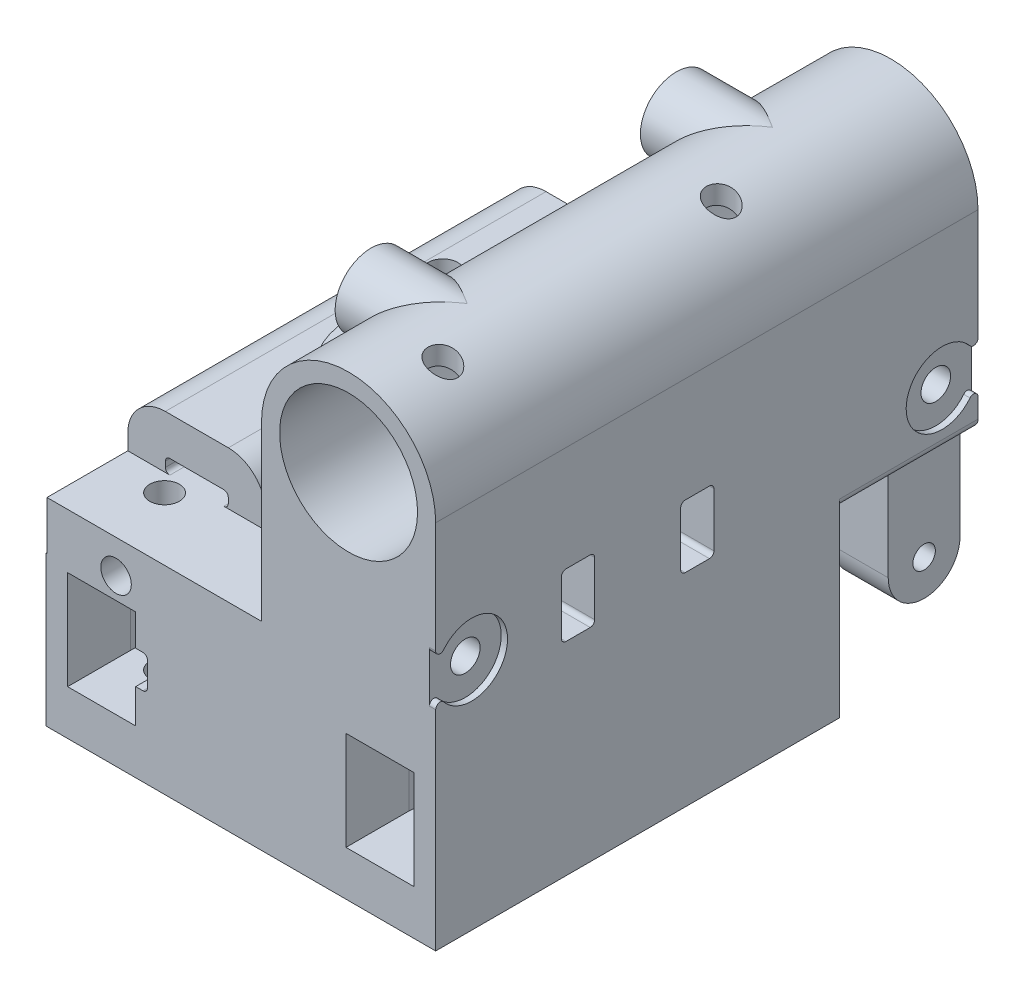
from build123d import *

# Parameters (mm, degrees)
SKETCH1_R                       = 7.68
SKETCH1_R_2                     = 1.7
BOSS_EXTRUDE1_DEPTH             = 60.4
BOSS_EXTRUDE3_DEPTH             = 34.02
SKETCH4_R                       = 8.49
CUT_EXTRUDE1_DEPTH              = 32
CUT_EXTRUDE2_DEPTH              = 30.2
CUT_EXTRUDE4_REACH              = 87.073
SKETCH3_R                       = 1.65
CUT_EXTRUDE5_DEPTH              = 0.7
SKETCH10_R                      = 3.6
CUT_EXTRUDE6_DEPTH              = 0.4
CUT_EXTRUDE8_DEPTH              = 15.4
CUT_EXTRUDE9_DEPTH              = 9
SKETCH6_R                       = 1.65
CUT_EXTRUDE10_DEPTH             = 86.935150038
SKETCH16_R                      = 11.5
CUT_EXTRUDE11_DEPTH             = 2.5
CUT_EXTRUDE12_START             = -9
CUT_EXTRUDE12_DEPTH             = 9
CUT_EXTRUDE13_START             = -5
SKETCH12_R                      = 3.79
CUT_EXTRUDE13_DEPTH             = 11
BOSS_EXTRUDE4_REACH             = 79.006
BOSS_EXTRUDE4_END_RADIUS        = 9.7
SKETCH20_R                      = 4
BOSS_EXTRUDE4_DIRECTION_2_DEPTH = 1
CUT_EXTRUDE14_REACH             = 78.7
SKETCH19_R                      = 1.65
BOSS_EXTRUDE5_START             = -2
SKETCH21_R                      = 1.25
BOSS_EXTRUDE5_DEPTH             = 6
CUT_EXTRUDE15_DEPTH             = 8


with BuildPart() as part:
    # Sketch1 → Boss-Extrude1 (new body)
    with BuildSketch(Plane.XY):
        with BuildLine():
            Line((9.7, 0), (9.7, -41.3))
            Line((9.7, -41.3), (-33.7, -41.3))
            Line((-33.7, -41.3), (-33.7, -24.62))
            Line((-33.7, -24.62), (-33.589997203, -24.62))
            Line((-33.589997203, -24.62), (-33.589997203, -17.49))
            ThreePointArc((-33.589997203, -17.49), (-32.365704368, -14.534295632), (-29.41, -13.310002796))
            Line((-29.41, -13.310002796), (-22.39, -13.310002796))
            ThreePointArc((-22.39, -13.310002796), (-19.434295632, -14.534295632), (-18.210002796, -17.49))
            Line((-18.210002796, -17.49), (-18.210002796, -19.2))
            Line((-18.210002796, -19.2), (-9.7, -19.2))
            Line((-9.7, -19.2), (-9.7, 0))
            ThreePointArc((-9.7, 0), (0, 9.7), (9.7, 0))
        make_face()
        Circle(SKETCH1_R, mode=Mode.SUBTRACT)
        with Locations((-25.900005593, -22.91)):
            Circle(SKETCH1_R_2, mode=Mode.SUBTRACT)
        with BuildLine():
            Line((-29.4, -31.999997203), (-29.4, -29.299997203))
            ThreePointArc((-29.4, -29.299997203), (-29.253553391, -28.946443813), (-28.9, -28.799997203))
            Line((-28.9, -28.799997203), (-22.900011186, -28.799997203))
            ThreePointArc((-22.900011186, -28.799997203), (-22.546457795, -28.946443813), (-22.400011186, -29.299997203))
            Line((-22.400011186, -29.299997203), (-22.400011186, -31.999997203))
            ThreePointArc((-22.400011186, -31.999997203), (-22.546457795, -32.353550594), (-22.900011186, -32.499997203))
            Line((-22.900011186, -32.499997203), (-28.9, -32.499997203))
            ThreePointArc((-28.9, -32.499997203), (-29.253553391, -32.353550594), (-29.4, -31.999997203))
        make_face(mode=Mode.SUBTRACT)
        with BuildLine():
            Line((-29.4, -18.1), (-29.4, -18.699994407))
            ThreePointArc((-29.4, -18.699994407), (-29.253555368, -19.053551413), (-28.9, -19.2))
            Line((-28.9, -19.2), (-22.9, -19.2))
            ThreePointArc((-22.9, -19.2), (-22.546446609, -19.053553391), (-22.4, -18.7))
            Line((-22.4, -18.7), (-22.4, -18.1))
            ThreePointArc((-22.4, -18.1), (-22.546446609, -17.746446609), (-22.9, -17.6))
            Line((-22.9, -17.6), (-28.9, -17.6))
            ThreePointArc((-28.9, -17.6), (-29.253553391, -17.746446609), (-29.4, -18.1))
        make_face(mode=Mode.SUBTRACT)
    extrude(amount=BOSS_EXTRUDE1_DEPTH)

    # Sketch8 → Boss-Extrude3 (add)
    with BuildSketch(Plane(origin=(0, -41.3, 0), x_dir=(1, 0, 0), z_dir=(0, 1, 0))):
        with BuildLine():
            Line((-12, -48.01), (-7.68, -48.01))
            Line((-7.68, -48.01), (-7.68, -27.79))
            Line((-7.68, -27.79), (-12, -27.79))
            ThreePointArc((-12, -27.79), (-22.11, -37.9), (-12, -48.01))
        make_face()
    extrude(amount=BOSS_EXTRUDE3_DEPTH)

    # Sketch4 → Cut-Extrude1 (cut)
    with BuildSketch(Plane.XZ.offset(41.3)):
        with Locations((-12, 37.9)):
            Circle(SKETCH4_R)
    extrude(amount=-CUT_EXTRUDE1_DEPTH, mode=Mode.SUBTRACT)

    # Sketch2 → Cut-Extrude2 (cut)
    with BuildSketch(Plane(origin=(0, 0, 0), x_dir=(-1, 0, 0), z_dir=(0, 0, -1))):
        with BuildLine():
            Line((22.39, -15.34), (29.41, -15.34))
            ThreePointArc((29.41, -15.34), (30.93027958, -15.96972042), (31.56, -17.49))
            Line((31.56, -17.49), (31.56, -24.62))
            ThreePointArc((31.56, -24.62), (30.93027958, -26.14027958), (29.41, -26.77))
            Line((29.41, -26.77), (22.39, -26.77))
            ThreePointArc((22.39, -26.77), (20.86972042, -26.14027958), (20.24, -24.62))
            Line((20.24, -24.62), (20.24, -17.49))
            ThreePointArc((20.24, -17.49), (20.86972042, -15.96972042), (22.39, -15.34))
        make_face()
    extrude(amount=-CUT_EXTRUDE2_DEPTH, mode=Mode.SUBTRACT)

    # Sketch3 → Cut-Extrude4 (cut, up to next)
    with BuildSketch(Plane(origin=(9.7, 0, 0), x_dir=(0, 0, -1), z_dir=(1, 0, 0)), mode=Mode.PRIVATE) as cut_extrude4_sk1:
        with Locations((-4, -15.2)):
            Circle(SKETCH3_R)
    cut_extrude4_tool1 = extrude(cut_extrude4_sk1.sketch, amount=-CUT_EXTRUDE4_REACH, mode=Mode.PRIVATE) & part.part
    # Sketch3 → Cut-Extrude4 (cut, up to next)
    with BuildSketch(Plane(origin=(9.7, 0, 0), x_dir=(0, 0, -1), z_dir=(1, 0, 0)), mode=Mode.PRIVATE) as cut_extrude4_sk2:
        with Locations((-56.4, -15.2)):
            Circle(SKETCH3_R)
    cut_extrude4_tool2 = extrude(cut_extrude4_sk2.sketch, amount=-CUT_EXTRUDE4_REACH, mode=Mode.PRIVATE) & part.part
    # Sketch3 → Cut-Extrude4 (cut, up to next)
    with BuildSketch(Plane(origin=(9.7, 0, 0), x_dir=(0, 0, -1), z_dir=(1, 0, 0)), mode=Mode.PRIVATE) as cut_extrude4_sk3:
        with BuildLine():
            Line((-46.39, -12.200005593), (-46.39, -18.199994407))
            ThreePointArc((-46.39, -18.199994407), (-46.243553391, -18.553547798), (-45.89, -18.699994407))
            Line((-45.89, -18.699994407), (-43.19, -18.699994407))
            ThreePointArc((-43.19, -18.699994407), (-42.836446609, -18.553547798), (-42.69, -18.199994407))
            Line((-42.69, -18.199994407), (-42.69, -12.200005593))
            ThreePointArc((-42.69, -12.200005593), (-42.836446609, -11.846452202), (-43.19, -11.700005593))
            Line((-43.19, -11.700005593), (-45.89, -11.700005593))
            ThreePointArc((-45.89, -11.700005593), (-46.243553391, -11.846452202), (-46.39, -12.200005593))
        make_face()
    cut_extrude4_tool3 = extrude(cut_extrude4_sk3.sketch, amount=-CUT_EXTRUDE4_REACH, mode=Mode.PRIVATE) & part.part
    # Sketch3 → Cut-Extrude4 (cut, up to next)
    with BuildSketch(Plane(origin=(9.7, 0, 0), x_dir=(0, 0, -1), z_dir=(1, 0, 0)), mode=Mode.PRIVATE) as cut_extrude4_sk4:
        with BuildLine():
            Line((-33.11, -12.200005593), (-33.11, -18.199994407))
            ThreePointArc((-33.11, -18.199994407), (-32.963553391, -18.553547798), (-32.61, -18.699994407))
            Line((-32.61, -18.699994407), (-29.91, -18.699994407))
            ThreePointArc((-29.91, -18.699994407), (-29.556446609, -18.553547798), (-29.41, -18.199994407))
            Line((-29.41, -18.199994407), (-29.41, -12.200005593))
            ThreePointArc((-29.41, -12.200005593), (-29.556446609, -11.846452202), (-29.91, -11.700005593))
            Line((-29.91, -11.700005593), (-32.61, -11.700005593))
            ThreePointArc((-32.61, -11.700005593), (-32.963553391, -11.846452202), (-33.11, -12.200005593))
        make_face()
    cut_extrude4_tool4 = extrude(cut_extrude4_sk4.sketch, amount=-CUT_EXTRUDE4_REACH, mode=Mode.PRIVATE) & part.part
    add(cut_extrude4_tool1.solids().sort_by_distance((9.7, -15.2, 4))[0], mode=Mode.SUBTRACT)
    add(cut_extrude4_tool2.solids().sort_by_distance((9.7, -15.2, 56.4))[0], mode=Mode.SUBTRACT)
    add(cut_extrude4_tool3.solids().sort_by_distance((9.7, -15.2, 44.54))[0], mode=Mode.SUBTRACT)
    add(cut_extrude4_tool4.solids().sort_by_distance((9.7, -15.2, 31.26))[0], mode=Mode.SUBTRACT)

    # Sketch9 → Cut-Extrude5 (cut)
    with BuildSketch(Plane(origin=(9.7, 0, 0), x_dir=(0, 0, -1), z_dir=(1, 0, 0))):
        with BuildLine():
            Line((-60.4, -12.371572875), (-60.4, -18.028427125))
            ThreePointArc((-60.4, -18.028427125), (-60.066666667, -17.557022604), (-59.511111111, -17.714157444))
            ThreePointArc((-59.511111111, -17.714157444), (-52.4, -15.2), (-59.511111111, -12.685842556))
            ThreePointArc((-59.511111111, -12.685842556), (-60.066666667, -12.842977396), (-60.4, -12.371572875))
        make_face()
        with BuildLine():
            Line((0, -12.371572875), (0, -18.028427125))
            ThreePointArc((0, -18.028427125), (-0.333333333, -17.557022604), (-0.888888889, -17.714157444))
            ThreePointArc((-0.888888889, -17.714157444), (-8, -15.2), (-0.888888889, -12.685842556))
            ThreePointArc((-0.888888889, -12.685842556), (-0.333333333, -12.842977396), (0, -12.371572875))
        make_face()
    extrude(amount=-CUT_EXTRUDE5_DEPTH, mode=Mode.SUBTRACT)

    # Sketch10 → Cut-Extrude6 (cut)
    with BuildSketch(Plane.ZY.offset(9.7)):
        with Locations((4, -15.2)):
            Circle(SKETCH10_R)
        with Locations((56.4, -15.2)):
            Circle(SKETCH10_R)
    extrude(amount=-CUT_EXTRUDE6_DEPTH, mode=Mode.SUBTRACT)

    # Sketch14 → Cut-Extrude8 (cut)
    with BuildSketch(Plane(origin=(0, 0, 0), x_dir=(-1, 0, 0), z_dir=(0, 0, -1))):
        with BuildLine():
            Line((-9.7, -20.2), (-9.7, -41.3))
            Line((-9.7, -41.3), (33.7, -41.3))
            Line((33.7, -41.3), (33.7, -24.62))
            Line((33.7, -24.62), (33.589997203, -24.62))
            ThreePointArc((33.589997203, -24.62), (32.365704368, -27.575704368), (29.41, -28.799997203))
            Line((29.41, -28.799997203), (22.39, -28.799997203))
            ThreePointArc((22.39, -28.799997203), (19.434295632, -27.575704368), (18.210002796, -24.62))
            Line((18.210002796, -24.62), (18.210002796, -19.2))
            Line((18.210002796, -19.2), (9.7, -19.2))
            Line((9.7, -19.2), (9.7, -20.2))
            ThreePointArc((9.7, -20.2), (9.407106781, -20.907106781), (8.7, -21.2))
            Line((8.7, -21.2), (-8.7, -21.2))
            ThreePointArc((-8.7, -21.2), (-9.407106781, -20.907106781), (-9.7, -20.2))
        make_face()
    extrude(amount=-CUT_EXTRUDE8_DEPTH, mode=Mode.SUBTRACT)

    # Sketch15 → Cut-Extrude9 (cut)
    with BuildSketch(Plane(origin=(0, 0, 0), x_dir=(-1, 0, 0), z_dir=(0, 0, -1))):
        with BuildLine():
            Line((22.39, -13.2), (29.41, -13.2))
            ThreePointArc((29.41, -13.2), (32.443488091, -14.456511909), (33.7, -17.49))
            Line((33.7, -17.49), (33.7, -24.62))
            ThreePointArc((33.7, -24.62), (32.443488091, -27.653488091), (29.41, -28.91))
            Line((29.41, -28.91), (22.39, -28.91))
            ThreePointArc((22.39, -28.91), (19.356511909, -27.653488091), (18.1, -24.62))
            Line((18.1, -24.62), (18.1, -17.49))
            ThreePointArc((18.1, -17.49), (19.356511909, -14.456511909), (22.39, -13.2))
        make_face()
    extrude(amount=-CUT_EXTRUDE9_DEPTH, mode=Mode.SUBTRACT)

    # Sketch6 → Cut-Extrude10 (cut, through all)
    with BuildSketch(Plane.XZ.offset(41.3)):
        with Locations((3.5, 53.4)):
            Circle(SKETCH6_R)
        with Locations((-27.5, 53.4)):
            Circle(SKETCH6_R)
        with Locations((-27.5, 22.4)):
            Circle(SKETCH6_R)
        with Locations((3.5, 22.4)):
            Circle(SKETCH6_R)
    extrude(amount=-CUT_EXTRUDE10_DEPTH, mode=Mode.SUBTRACT)

    # Sketch16 → Cut-Extrude11 (cut)
    with BuildSketch(Plane.XZ.offset(41.3)):
        with Locations((-12, 37.9)):
            Circle(SKETCH16_R)
    extrude(amount=-CUT_EXTRUDE11_DEPTH, mode=Mode.SUBTRACT)

    # Sketch17 → Cut-Extrude12 (cut)
    with BuildSketch(Plane.XY.offset(60.4).offset(CUT_EXTRUDE12_START)):
        with BuildLine():
            Line((-29.41, -13.310002796), (-22.39, -13.310002796))
            ThreePointArc((-22.39, -13.310002796), (-19.434295632, -14.534295632), (-18.210002796, -17.49))
            Line((-18.210002796, -17.49), (-18.210002796, -19.2))
            Line((-18.210002796, -19.2), (-33.589997203, -19.2))
            Line((-33.589997203, -19.2), (-33.589997203, -17.49))
            ThreePointArc((-33.589997203, -17.49), (-32.365704368, -14.534295632), (-29.41, -13.310002796))
        make_face()
    extrude(amount=CUT_EXTRUDE12_DEPTH, mode=Mode.SUBTRACT)

    # Sketch12 → Cut-Extrude13 (cut)
    with BuildSketch(Plane.XZ.offset(41.3).offset(CUT_EXTRUDE13_START)):
        with Locations((-27.5, 22.4)):
            Circle(SKETCH12_R)
        with BuildLine():
            Line((-31.29, 53.4), (-31.29, 60.4))
            Line((-31.29, 60.4), (-23.71, 60.4))
            Line((-23.71, 60.4), (-23.71, 53.4))
            ThreePointArc((-23.71, 53.4), (-27.5, 49.61), (-31.29, 53.4))
        make_face()
        with BuildLine():
            Line((-0.29, 53.4), (-0.29, 60.4))
            Line((-0.29, 60.4), (7.29, 60.4))
            Line((7.29, 60.4), (7.29, 53.4))
            ThreePointArc((7.29, 53.4), (3.5, 49.61), (-0.29, 53.4))
        make_face()
        with BuildLine():
            Line((-0.29, 22.4), (-0.29, 15.4))
            Line((-0.29, 15.4), (7.29, 15.4))
            Line((7.29, 15.4), (7.29, 22.4))
            ThreePointArc((7.29, 22.4), (3.5, 26.19), (-0.29, 22.4))
        make_face()
    extrude(amount=-CUT_EXTRUDE13_DEPTH, mode=Mode.SUBTRACT)

    # Boss-Extrude4: up to this cylinder (the profile starts outside it)
    boss_extrude4_end = Plane(origin=(0, 0, 30.2), z_dir=(0, 0, -1)) * Cylinder(BOSS_EXTRUDE4_END_RADIUS, 212.412, mode=Mode.PRIVATE)
    # Sketch20 → Boss-Extrude4 (add, up to the surface)
    with BuildSketch(Plane.ZY.offset(9.7), mode=Mode.PRIVATE) as boss_extrude4_sk1:
        with Locations((13.2, 5.7)):
            Circle(SKETCH20_R)
    boss_extrude4_tool1 = extrude(boss_extrude4_sk1.sketch, amount=-BOSS_EXTRUDE4_REACH, mode=Mode.PRIVATE) - boss_extrude4_end
    add(boss_extrude4_tool1.solids().sort_by_distance((-9.7, 5.7, 13.2))[0])
    # Sketch20 → Boss-Extrude4 (add, up to the surface)
    with BuildSketch(Plane.ZY.offset(9.7), mode=Mode.PRIVATE) as boss_extrude4_sk2:
        with Locations((47.2, 5.7)):
            Circle(SKETCH20_R)
    boss_extrude4_tool2 = extrude(boss_extrude4_sk2.sketch, amount=-BOSS_EXTRUDE4_REACH, mode=Mode.PRIVATE) - boss_extrude4_end
    add(boss_extrude4_tool2.solids().sort_by_distance((-9.7, 5.7, 47.2))[0])

    # Sketch20 → Boss-Extrude4 direction 2 (add)
    with BuildSketch(Plane.ZY.offset(9.7)):
        with Locations((13.2, 5.7)):
            Circle(SKETCH20_R)
        with Locations((47.2, 5.7)):
            Circle(SKETCH20_R)
    extrude(amount=BOSS_EXTRUDE4_DIRECTION_2_DEPTH)

    # Sketch19 → Cut-Extrude14 (cut, up to next)
    with BuildSketch(Plane.ZY.offset(10.7), mode=Mode.PRIVATE) as cut_extrude14_sk1:
        with Locations((13.2, 5.7)):
            Circle(SKETCH19_R)
    cut_extrude14_tool1 = extrude(cut_extrude14_sk1.sketch, amount=-CUT_EXTRUDE14_REACH, mode=Mode.PRIVATE) & part.part
    # Sketch19 → Cut-Extrude14 (cut, up to next)
    with BuildSketch(Plane.ZY.offset(10.7), mode=Mode.PRIVATE) as cut_extrude14_sk2:
        with Locations((47.2, 5.7)):
            Circle(SKETCH19_R)
    cut_extrude14_tool2 = extrude(cut_extrude14_sk2.sketch, amount=-CUT_EXTRUDE14_REACH, mode=Mode.PRIVATE) & part.part
    add(cut_extrude14_tool1.solids().sort_by_distance((-10.7, 5.7, 13.2))[0], mode=Mode.SUBTRACT)
    add(cut_extrude14_tool2.solids().sort_by_distance((-10.7, 5.7, 47.2))[0], mode=Mode.SUBTRACT)

    # Sketch21 → Boss-Extrude5 (add)
    with BuildSketch(Plane(origin=(9.7, 0, 0), x_dir=(0, 0, -1), z_dir=(1, 0, 0)).offset(BOSS_EXTRUDE5_START)):
        with BuildLine():
            Line((-8, -32.5), (-8, -21.2))
            Line((-8, -21.2), (0, -21.2))
            Line((0, -21.2), (0, -32.5))
            ThreePointArc((0, -32.5), (-4, -36.5), (-8, -32.5))
        make_face()
        with Locations((-4, -32.5)):
            Circle(SKETCH21_R, mode=Mode.SUBTRACT)
    extrude(amount=-BOSS_EXTRUDE5_DEPTH)

    # Sketch22 → Cut-Extrude15 (cut)
    with BuildSketch(Plane(origin=(0, 0, 30.2), x_dir=(-1, 0, 0), z_dir=(0, 0, -1))):
        with BuildLine():
            Line((22.9, -16.9), (28.9, -16.9))
            ThreePointArc((28.9, -16.9), (29.253553391, -17.046446609), (29.4, -17.4))
            Line((29.4, -17.4), (29.4, -18.7))
            ThreePointArc((29.4, -18.7), (29.253553391, -19.053553391), (28.9, -19.2))
            Line((28.9, -19.2), (22.9, -19.2))
            ThreePointArc((22.9, -19.2), (22.546446609, -19.053553391), (22.4, -18.7))
            Line((22.4, -18.7), (22.4, -17.4))
            ThreePointArc((22.4, -17.4), (22.546446609, -17.046446609), (22.9, -16.9))
        make_face()
    extrude(amount=-CUT_EXTRUDE15_DEPTH, mode=Mode.SUBTRACT)


solid = part.part
